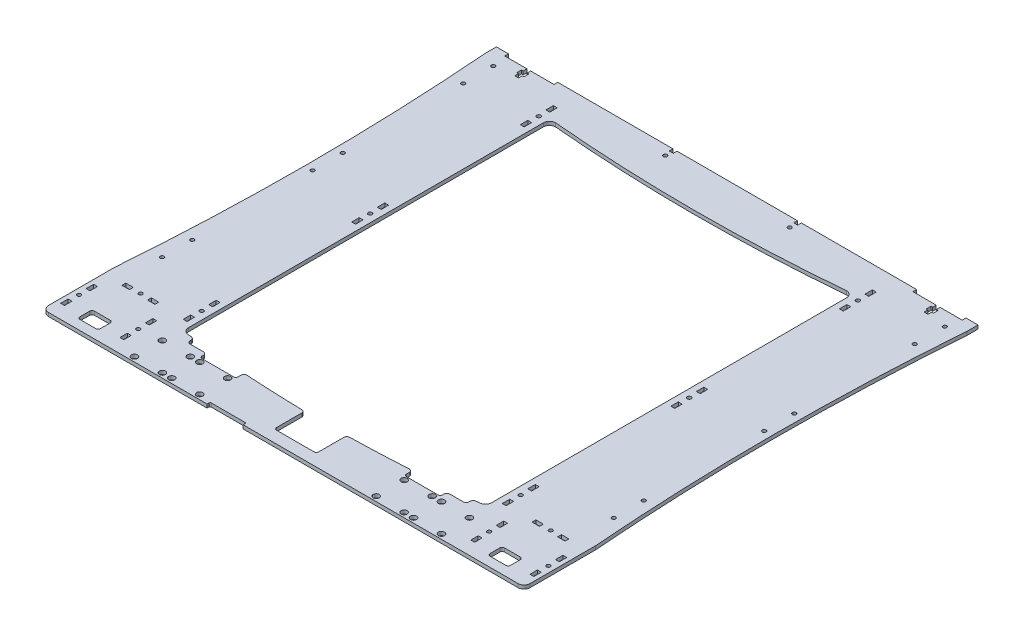
from build123d import *

# Parameters (mm, degrees)
CROQUIS1_W              = 3.2
CROQUIS1_H              = 6.2
CROQUIS1_R              = 1.55
CROQUIS1_R_2            = 2.55
CROQUIS1_W_2            = 6.2
CROQUIS1_H_2            = 3.2
CROQUIS1_R_3            = 1.6
SALIENTE_EXTRUIR1_DEPTH = 3
CORTAR_EXTRUIR1_DEPTH   = 3
REDONDEO1_R             = 5
CORTAR_EXTRUIR3_DEPTH   = 3
CROQUIS5_W              = 30
CROQUIS5_H              = 11
CROQUIS5_W_2            = 35
CROQUIS5_H_2            = 25.246672812
CORTAR_EXTRUIR4_DEPTH   = 3
REDONDEO2_R             = 2
CORTAR_EXTRUIR5_DEPTH   = 3
CROQUIS7_W              = 16
CROQUIS7_H              = 5.5
CORTAR_EXTRUIR6_DEPTH   = 3
REDONDEO3_R             = 2.5


with BuildPart() as part:
    # Croquis1 → Saliente-Extruir1 (new body)
    with BuildSketch(Plane(origin=(0, 0, 0), x_dir=(1, 0, 0), z_dir=(0, 1, 0))):
        Polygon((0, 377), (0, 0), (400, 0), (400, 377), (390, 377), (390, 373.9), (371.6, 373.9), (371.6, 370.9), (373, 370.9), (373, 366.9), (371.6, 366.9), (371.6, 363.9), (368.4, 363.9), (368.4, 366.9), (367, 366.9), (367, 370.9), (368.4, 370.9), (368.4, 373.9), (349, 373.9), (349, 377), (253.3, 377), (253.3, 373.9), (250, 373.9), (250, 377), (150, 377), (150, 373.9), (146.7, 373.9), (146.7, 377), (51, 377), (51, 373.9), (31.6, 373.9), (31.6, 370.9), (33, 370.9), (33, 366.9), (31.6, 366.9), (31.6, 363.9), (28.4, 363.9), (28.4, 366.9), (27, 366.9), (27, 370.9), (28.4, 370.9), (28.4, 373.9), (10, 373.9), (10, 377), align=None)
        with Locations((5.1, 14.7)):
            Rectangle(CROQUIS1_W, CROQUIS1_H, mode=Mode.SUBTRACT)
        with Locations(Location((5.1, 25.3, 0), (0, 0, 270))):
            Circle(CROQUIS1_R, mode=Mode.SUBTRACT)
        with Locations((5.1, 35.9)):
            Rectangle(CROQUIS1_W, CROQUIS1_H, mode=Mode.SUBTRACT)
        with Locations(Location((72.5, 3.9, 0), (0, 0, 270))):
            Circle(CROQUIS1_R_2, mode=Mode.SUBTRACT)
        with Locations((54.3, 14.7)):
            Rectangle(CROQUIS1_W, CROQUIS1_H, mode=Mode.SUBTRACT)
        with Locations(Location((95.7, 3.9, 0), (0, 0, 270))):
            Circle(CROQUIS1_R_2, mode=Mode.SUBTRACT)
        with Locations(Location((54.3, 25.3, 0), (0, 0, 270))):
            Circle(CROQUIS1_R, mode=Mode.SUBTRACT)
        with Locations(Location((72.5, 27.1, 0), (0, 0, 270))):
            Circle(CROQUIS1_R_2, mode=Mode.SUBTRACT)
        with Locations((54.3, 35.9)):
            Rectangle(CROQUIS1_W, CROQUIS1_H, mode=Mode.SUBTRACT)
        with Locations(Location((95.7, 27.1, 0), (0, 0, 270))):
            Circle(CROQUIS1_R_2, mode=Mode.SUBTRACT)
        with Locations((19.1, 51.6)):
            Rectangle(CROQUIS1_W_2, CROQUIS1_H_2, mode=Mode.SUBTRACT)
        with Locations(Location((29.7, 51.8, 0), (0, 0, 270))):
            Circle(CROQUIS1_R, mode=Mode.SUBTRACT)
        with Locations((40.3, 51.6)):
            Rectangle(CROQUIS1_W_2, CROQUIS1_H_2, mode=Mode.SUBTRACT)
        with Locations(Location((12.5, 86.9, 0), (0, 0, 270))):
            Circle(CROQUIS1_R, mode=Mode.SUBTRACT)
        with Locations((67.5, 54.1)):
            Rectangle(CROQUIS1_W, CROQUIS1_H, mode=Mode.SUBTRACT)
        with Locations(Location((67.5, 64.7, 0), (0, 0, 270))):
            Circle(CROQUIS1_R_3, mode=Mode.SUBTRACT)
        with Locations((67.5, 75.3)):
            Rectangle(CROQUIS1_W, CROQUIS1_H, mode=Mode.SUBTRACT)
        with Locations(Location((103.5, 3.9, 0), (0, 0, 270))):
            Circle(CROQUIS1_R_2, mode=Mode.SUBTRACT)
        with Locations(Location((126.7, 3.9, 0), (0, 0, 270))):
            Circle(CROQUIS1_R_2, mode=Mode.SUBTRACT)
        with Locations(Location((103.5, 27.1, 0), (0, 0, 270))):
            Circle(CROQUIS1_R_2, mode=Mode.SUBTRACT)
        with Locations(Location((126.7, 27.1, 0), (0, 0, 270))):
            Circle(CROQUIS1_R_2, mode=Mode.SUBTRACT)
        with Locations(Location((12.5, 111.9, 0), (0, 0, 270))):
            Circle(CROQUIS1_R, mode=Mode.SUBTRACT)
        with Locations(Location((273.3, 3.9, 0), (0, 0, 270))):
            Circle(CROQUIS1_R_2, mode=Mode.SUBTRACT)
        with Locations(Location((296.5, 3.9, 0), (0, 0, 270))):
            Circle(CROQUIS1_R_2, mode=Mode.SUBTRACT)
        with Locations(Location((273.3, 27.1, 0), (0, 0, 270))):
            Circle(CROQUIS1_R_2, mode=Mode.SUBTRACT)
        with Locations(Location((296.5, 27.1, 0), (0, 0, 270))):
            Circle(CROQUIS1_R_2, mode=Mode.SUBTRACT)
        with Locations(Location((304.3, 3.9, 0), (0, 0, 270))):
            Circle(CROQUIS1_R_2, mode=Mode.SUBTRACT)
        with Locations(Location((327.5, 3.9, 0), (0, 0, 270))):
            Circle(CROQUIS1_R_2, mode=Mode.SUBTRACT)
        with Locations((345.7, 14.7)):
            Rectangle(CROQUIS1_W, CROQUIS1_H, mode=Mode.SUBTRACT)
        with Locations(Location((304.3, 27.1, 0), (0, 0, 270))):
            Circle(CROQUIS1_R_2, mode=Mode.SUBTRACT)
        with Locations(Location((327.5, 27.1, 0), (0, 0, 270))):
            Circle(CROQUIS1_R_2, mode=Mode.SUBTRACT)
        with Locations(Location((345.7, 25.3, 0), (0, 0, 270))):
            Circle(CROQUIS1_R, mode=Mode.SUBTRACT)
        with Locations((345.7, 35.9)):
            Rectangle(CROQUIS1_W, CROQUIS1_H, mode=Mode.SUBTRACT)
        with Locations((394.9, 14.7)):
            Rectangle(CROQUIS1_W, CROQUIS1_H, mode=Mode.SUBTRACT)
        with Locations(Location((394.9, 25.3, 0), (0, 0, 270))):
            Circle(CROQUIS1_R, mode=Mode.SUBTRACT)
        with Locations((394.9, 35.9)):
            Rectangle(CROQUIS1_W, CROQUIS1_H, mode=Mode.SUBTRACT)
        with Locations((332.5, 54.1)):
            Rectangle(CROQUIS1_W, CROQUIS1_H, mode=Mode.SUBTRACT)
        with Locations(Location((332.5, 64.7, 0), (0, 0, 270))):
            Circle(CROQUIS1_R_3, mode=Mode.SUBTRACT)
        with Locations((332.5, 75.3)):
            Rectangle(CROQUIS1_W, CROQUIS1_H, mode=Mode.SUBTRACT)
        with Locations((359.7, 51.6)):
            Rectangle(CROQUIS1_W_2, CROQUIS1_H_2, mode=Mode.SUBTRACT)
        with Locations(Location((370.3, 51.8, 0), (0, 0, 270))):
            Circle(CROQUIS1_R, mode=Mode.SUBTRACT)
        with Locations((380.9, 51.6)):
            Rectangle(CROQUIS1_W_2, CROQUIS1_H_2, mode=Mode.SUBTRACT)
        with Locations(Location((387.5, 86.9, 0), (0, 0, 270))):
            Circle(CROQUIS1_R, mode=Mode.SUBTRACT)
        with Locations(Location((387.5, 111.9, 0), (0, 0, 270))):
            Circle(CROQUIS1_R, mode=Mode.SUBTRACT)
        with Locations(Location((12.5, 211.9, 0), (0, 0, 270))):
            Circle(CROQUIS1_R, mode=Mode.SUBTRACT)
        with Locations((67.5, 194.1)):
            Rectangle(CROQUIS1_W, CROQUIS1_H, mode=Mode.SUBTRACT)
        with Locations(Location((67.5, 204.7, 0), (0, 0, 270))):
            Circle(CROQUIS1_R_3, mode=Mode.SUBTRACT)
        with Locations((67.5, 215.3)):
            Rectangle(CROQUIS1_W, CROQUIS1_H, mode=Mode.SUBTRACT)
        with Locations(Location((12.5, 236.9, 0), (0, 0, 270))):
            Circle(CROQUIS1_R, mode=Mode.SUBTRACT)
        with Locations(Location((12.5, 336.9, 0), (0, 0, 270))):
            Circle(CROQUIS1_R, mode=Mode.SUBTRACT)
        with Locations(Location((12.5, 361.9, 0), (0, 0, 270))):
            Circle(CROQUIS1_R, mode=Mode.SUBTRACT)
        with Locations((67.5, 334.1)):
            Rectangle(CROQUIS1_W, CROQUIS1_H, mode=Mode.SUBTRACT)
        with Locations(Location((67.5, 344.7, 0), (0, 0, 270))):
            Circle(CROQUIS1_R_3, mode=Mode.SUBTRACT)
        with Locations((67.5, 355.3)):
            Rectangle(CROQUIS1_W, CROQUIS1_H, mode=Mode.SUBTRACT)
        with Locations(Location((148.35, 368.9, 0), (0, 0, 270))):
            Circle(CROQUIS1_R, mode=Mode.SUBTRACT)
        with Locations((332.5, 194.1)):
            Rectangle(CROQUIS1_W, CROQUIS1_H, mode=Mode.SUBTRACT)
        with Locations(Location((332.5, 204.7, 0), (0, 0, 270))):
            Circle(CROQUIS1_R_3, mode=Mode.SUBTRACT)
        with Locations((332.5, 215.3)):
            Rectangle(CROQUIS1_W, CROQUIS1_H, mode=Mode.SUBTRACT)
        with Locations(Location((387.5, 211.9, 0), (0, 0, 270))):
            Circle(CROQUIS1_R, mode=Mode.SUBTRACT)
        with Locations(Location((387.5, 236.9, 0), (0, 0, 270))):
            Circle(CROQUIS1_R, mode=Mode.SUBTRACT)
        with Locations(Location((251.65, 368.9, 0), (0, 0, 270))):
            Circle(CROQUIS1_R, mode=Mode.SUBTRACT)
        with Locations((332.5, 334.1)):
            Rectangle(CROQUIS1_W, CROQUIS1_H, mode=Mode.SUBTRACT)
        with Locations(Location((332.5, 344.7, 0), (0, 0, 270))):
            Circle(CROQUIS1_R_3, mode=Mode.SUBTRACT)
        with Locations((332.5, 355.3)):
            Rectangle(CROQUIS1_W, CROQUIS1_H, mode=Mode.SUBTRACT)
        with Locations(Location((387.5, 336.9, 0), (0, 0, 270))):
            Circle(CROQUIS1_R, mode=Mode.SUBTRACT)
        with Locations(Location((387.5, 361.9, 0), (0, 0, 270))):
            Circle(CROQUIS1_R, mode=Mode.SUBTRACT)
    extrude(amount=SALIENTE_EXTRUIR1_DEPTH)

    # Croquis2 → Cortar-Extruir1 (cut)
    with BuildSketch(Plane(origin=(0, 3, 0), x_dir=(1, 0, 0), z_dir=(0, 1, 0))):
        with BuildLine():
            Line((74.1, 342), (74.1, 47.1))
            ThreePointArc((74.1, 47.1), (75.564466094, 43.564466094), (79.1, 42.1))
            ThreePointArc((79.1, 42.1), (200, 35.100499668), (320.9, 42.1))
            ThreePointArc((320.9, 42.1), (324.435533906, 43.564466094), (325.9, 47.1))
            Line((325.9, 47.1), (325.9, 342))
            ThreePointArc((325.9, 342), (324.435533906, 345.535533906), (320.9, 347))
            ThreePointArc((320.9, 347), (200, 341.578561616), (79.1, 347))
            ThreePointArc((79.1, 347), (75.564466094, 345.535533906), (74.1, 342))
        make_face()
    extrude(amount=-CORTAR_EXTRUIR1_DEPTH, mode=Mode.SUBTRACT)

    # Redondeo1
    redondeo1_edges = [part.edges().sort_by_distance(p)[0] for p in [
        (400, 1.5, 0),
        (0, 1.5, 0),
    ]]
    fillet(redondeo1_edges, radius=REDONDEO1_R)

    # Croquis4 → Cortar-Extruir3 (cut)
    with BuildSketch(Plane(origin=(0, 3, 0), x_dir=(1, 0, 0), z_dir=(0, 1, 0))):
        with BuildLine():
            ThreePointArc((0, 368), (6, 213.6), (0, 59.2))
            Line((0, 59.2), (0, 368))
        make_face()
        with BuildLine():
            Line((400, 368), (400, 59.2))
            ThreePointArc((400, 59.2), (394, 213.6), (400, 368))
        make_face()
    extrude(amount=-CORTAR_EXTRUIR3_DEPTH, mode=Mode.SUBTRACT)

    # Croquis5 → Cortar-Extruir4 (cut)
    with BuildSketch(Plane(origin=(0, 3, 0), x_dir=(1, 0, 0), z_dir=(0, 1, 0))):
        with Locations((115.100000017, 36)):
            Rectangle(CROQUIS5_W, CROQUIS5_H)
        with Locations((284.899999983, 36)):
            Rectangle(CROQUIS5_W, CROQUIS5_H)
        with Locations((200, 22.623336406)):
            Rectangle(CROQUIS5_W_2, CROQUIS5_H_2)
        with BuildLine():
            Line((23.2, 20), (36.2, 20))
            ThreePointArc((36.2, 20), (37.614213562, 19.414213562), (38.2, 18))
            Line((38.2, 18), (38.2, 10))
            ThreePointArc((38.2, 10), (37.614213562, 8.585786438), (36.2, 8))
            Line((36.2, 8), (23.2, 8))
            ThreePointArc((23.2, 8), (21.785786438, 8.585786438), (21.2, 10))
            Line((21.2, 10), (21.2, 18))
            ThreePointArc((21.2, 18), (21.785786438, 19.414213562), (23.2, 20))
        make_face()
        with BuildLine():
            Line((378.8, 18), (378.8, 10))
            ThreePointArc((378.8, 10), (378.214213562, 8.585786438), (376.8, 8))
            Line((376.8, 8), (363.8, 8))
            ThreePointArc((363.8, 8), (362.385786438, 8.585786438), (361.8, 10))
            Line((361.8, 10), (361.8, 18))
            ThreePointArc((361.8, 18), (362.385786438, 19.414213562), (363.8, 20))
            Line((363.8, 20), (376.8, 20))
            ThreePointArc((376.8, 20), (378.214213562, 19.414213562), (378.8, 18))
        make_face()
    extrude(amount=-CORTAR_EXTRUIR4_DEPTH, mode=Mode.SUBTRACT)

    # Redondeo2
    redondeo2_edges = [part.edges().sort_by_distance(p)[0] for p in [
        (182.5, 1.5, -10),
        (217.5, 1.5, -10),
        (269.899999983, 1.5, -30.5),
        (299.899999983, 1.5, -30.5),
        (100.100000017, 1.5, -30.5),
        (130.100000017, 1.5, -30.5),
    ]]
    fillet(redondeo2_edges, radius=REDONDEO2_R)

    # Croquis6 → Cortar-Extruir5 (cut)
    with BuildSketch(Plane(origin=(0, 3, 0), x_dir=(1, 0, 0), z_dir=(0, 1, 0))):
        with BuildLine():
            Line((136.7, 0), (166.7, 0))
            Line((166.7, 0), (166.7, 1.5))
            ThreePointArc((166.7, 1.5), (166.407106781, 2.207106781), (165.7, 2.5))
            Line((165.7, 2.5), (137.7, 2.5))
            ThreePointArc((137.7, 2.5), (136.992893219, 2.207106781), (136.7, 1.5))
            Line((136.7, 1.5), (136.7, 0))
        make_face()
    extrude(amount=-CORTAR_EXTRUIR5_DEPTH, mode=Mode.SUBTRACT)

    # Croquis7 → Cortar-Extruir6 (cut)
    with BuildSketch(Plane(origin=(0, 3, 0), x_dir=(1, 0, 0), z_dir=(0, 1, 0))):
        with Locations((92.100000017, 38.781270697)):
            Rectangle(CROQUIS7_W, CROQUIS7_H)
        with Locations((307.899999983, 38.781270697)):
            Rectangle(CROQUIS7_W, CROQUIS7_H)
    extrude(amount=-CORTAR_EXTRUIR6_DEPTH, mode=Mode.SUBTRACT)

    # Redondeo3
    redondeo3_edges = [part.edges().sort_by_distance(p)[0] for p in [
        (130.100000017, 1.5, -37.435030967),
        (269.899999983, 1.5, -37.435030967),
        (182.5, 1.5, -35.246672812),
        (217.5, 1.5, -35.246672812),
        (100.100000017, 1.5, -36.031270697),
        (84.100000017, 1.5, -36.031270697),
        (84.100000017, 1.5, -41.531270697),
        (299.899999983, 1.5, -36.031270697),
        (315.899999983, 1.5, -41.531270697),
        (315.899999983, 1.5, -36.031270697),
    ]]
    fillet(redondeo3_edges, radius=REDONDEO3_R)


solid = part.part
